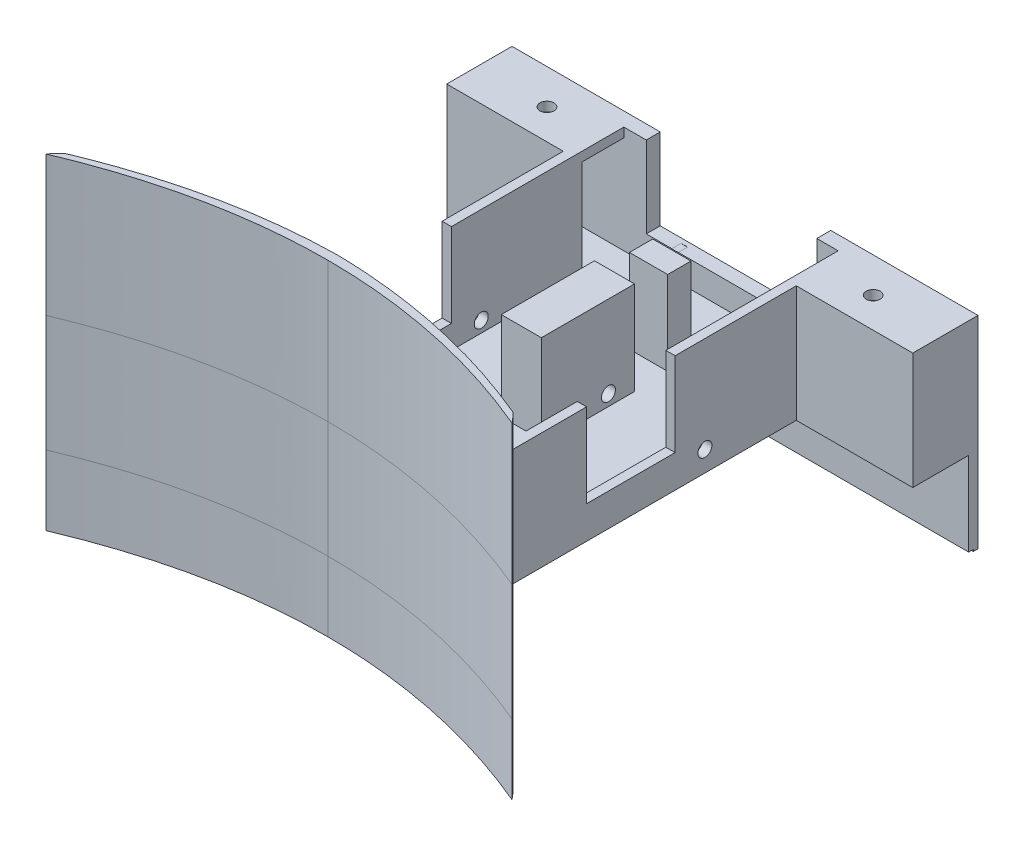
from build123d import *

# Parameters (mm, degrees)
SALIENTE_EXTRUIR1_DEPTH  = 25
VACIADO1_START           = 2
VACIADO1_DEPTH           = 23
CROQUIS3_W               = 10
CROQUIS3_H               = 18
CROQUIS3_W_2             = 5
CORTAR_EXTRUIR3_DEPTH    = 63
CROQUIS5_W               = 8.6
CROQUIS5_H               = 20
SALIENTE_EXTRUIR2_DEPTH  = 20
CROQUIS9_W               = 25
CROQUIS9_H               = 9
SALIENTE_EXTRUIR5_DEPTH  = 2
CORTAR_EXTRUIR4_DEPTH    = 13
SALIENTE_EXTRUIR8_DEPTH  = 30
SALIENTE_EXTRUIR9_DEPTH  = 15
SALIENTE_EXTRUIR11_REACH = 103.42
CROQUIS17_W              = 46
CROQUIS17_H              = 1
CORTAR_EXTRUIR5_REACH    = 83.24
CROQUIS18_W              = 26.5
CROQUIS18_H              = 17.5
CROQUIS19_R              = 1.5
CORTAR_EXTRUIR6_DEPTH    = 60
CORTAR_EXTRUIR7_REACH    = 83.24
CROQUIS20_R              = 1.5
CROQUIS21_W              = 4
CROQUIS21_H              = 18
CORTAR_EXTRUIR8_DEPTH    = 2
CROQUIS22_W              = 4
CROQUIS22_H              = 18
CORTAR_EXTRUIR9_DEPTH    = 2
CROQUIS23_W              = 36.597932746
CROQUIS23_H              = 17.450550814
CORTAR_EXTRUIR10_DEPTH   = 2
CROQUIS25_W              = 44.080721066
CROQUIS25_H              = 4.2
SALIENTE_EXTRUIR12_DEPTH = 18
CROQUIS29_W              = 3.5
CROQUIS29_H              = 4.2
CORTAR_EXTRUIR11_DEPTH   = 18
CROQUIS34_W              = 3.5
CROQUIS34_H              = 4.2
CORTAR_EXTRUIR12_DEPTH   = 18
CROQUIS35_W              = 8.2
CROQUIS35_H              = 5
SALIENTE_EXTRUIR13_DEPTH = 18
CROQUIS49_W              = 100
CROQUIS49_H              = 2
SALIENTE_EXTRUIR20_DEPTH = 14.5
CROQUIS50_W              = 100
CROQUIS50_H              = 1
SALIENTE_EXTRUIR21_DEPTH = 7.5
REDONDEO3_R              = 1
CROQUIS41_W              = 100
CROQUIS41_H              = 18.3920876
SALIENTE_EXTRUIR15_DEPTH = 1
CROQUIS46_W              = 100
CROQUIS46_H              = 18
SALIENTE_EXTRUIR17_DEPTH = 1
CROQUIS47_W              = 31.810608276
CROQUIS47_H              = 17.450550814
CROQUIS47_W_2            = 31.591458978
SALIENTE_EXTRUIR18_DEPTH = 1
CROQUIS48_W              = 100
CROQUIS48_H              = 7.549449186
SALIENTE_EXTRUIR19_DEPTH = 1


# Read off the part's stored shape, not the designer's step: Vaciado1, Saliente-Extruir8, Saliente-Extruir9
with BuildPart() as part:
    # Croquis1 → Saliente-Extruir1 (new body)
    with BuildSketch(Plane(origin=(0, 0, 0), x_dir=(1, 0, 0), z_dir=(0, 1, 0))):
        with BuildLine():
            Line((-50, 50), (50, 50))
            Line((50, 50), (50, 37))
            Line((50, 37), (25, 37))
            Line((25, 37), (25, -37))
            ThreePointArc((25, -37), (38.865424624, -40.155365367), (50, -49))
            add(Edge.make_bspline(
                [(50, -49), (25.069665495, -38.5), (0, -38.5)],
                knots=[0, 0, 0, 0.487509827, 0.487509827, 0.487509827], degree=2))
            add(Edge.make_bspline(
                [(-50, -49), (-25.069665495, -38.5), (0, -38.5)],
                knots=[0, 0, 0, 0.487509827, 0.487509827, 0.487509827], degree=2))
            ThreePointArc((-50, -49), (-38.865424624, -40.155365367), (-25, -37))
            Line((-25, -37), (-25, 37))
            Line((-25, 37), (-50, 37))
            Line((-50, 37), (-50, 50))
        make_face()
    extrude(amount=SALIENTE_EXTRUIR1_DEPTH)

    # Vaciado1 outline → Vaciado1 (cut)
    with BuildSketch(Plane(origin=(0, 0, 0), x_dir=(1, 0, 0), z_dir=(0, 1, 0)).offset(VACIADO1_START)):
        with BuildLine():
            ThreePointArc((40.360732069, -43.224043879), (32.7940153, -40.028651284), (24.64466366, -39.002101553))
            add(Edge.make_bspline(
                [(24.64466366, -39.002101553), (27.267975688, -39.535570601), (29.889798454, -40.137194866), (32.510049946, -40.806919812), (35.128659178, -41.544682347), (37.745568283, -42.350413884), (40.360732069, -43.224043879)],
                knots=[0.23606502, 0.23606502, 0.23606502, 0.23606502, 0.23606502, 0.23606502, 0.23606502, 0.387124221, 0.387124221, 0.387124221, 0.387124221, 0.387124221, 0.387124221, 0.387124221], degree=6))
        make_face()
        with BuildLine():
            ThreePointArc((-24.64466366, -39.002101553), (-32.7940153, -40.028651284), (-40.360732069, -43.224043879))
            add(Edge.make_bspline(
                [(-40.360732069, -43.224043879), (-37.745568283, -42.350413884), (-35.128659178, -41.544682347), (-32.510049946, -40.806919812), (-29.889798454, -40.137194866), (-27.267975688, -39.535570601), (-24.64466366, -39.002101553)],
                knots=[0.100385605, 0.100385605, 0.100385605, 0.100385605, 0.100385605, 0.100385605, 0.100385605, 0.251444807, 0.251444807, 0.251444807, 0.251444807, 0.251444807, 0.251444807, 0.251444807], degree=6))
        make_face()
        with BuildLine():
            Line((-23, 39), (-23.000000008, -38.678856831))
            add(Edge.make_bspline(
                [(-23.000000008, -38.678856831), (-19.173415883, -37.952848249), (-15.343739175, -37.371820066), (-11.511234649, -36.93593302), (-7.676214778, -36.645306639), (-3.839024177, -36.5), (3.839024177, -36.5), (7.676214778, -36.645306639), (11.511234649, -36.93593302), (15.343739175, -37.371820066), (19.173415883, -37.952848249), (23.000000008, -38.678856831)],
                knots=[0.267226703, 0.267226703, 0.267226703, 0.267226703, 0.267226703, 0.267226703, 0.267226703, 0.487509827, 0.487509827, 0.487509827, 0.487509827, 0.487509827, 0.70779295, 0.70779295, 0.70779295, 0.70779295, 0.70779295, 0.70779295, 0.70779295], degree=6))
            Line((23.000000008, -38.678856831), (23, 39))
            Line((23, 39), (48, 39))
            Line((48, 39), (48, 48))
            Line((48, 48), (-48, 48))
            Line((-48, 48), (-48, 39))
            Line((-48, 39), (-23, 39))
        make_face()
    extrude(amount=VACIADO1_DEPTH, mode=Mode.SUBTRACT)

    # Croquis3 → Cortar-Extruir3 (cut)
    with BuildSketch(Plane(origin=(25, 0, 0), x_dir=(0, 0, -1), z_dir=(1, 0, 0))):
        with Locations((-3, 16)):
            Rectangle(CROQUIS3_W, CROQUIS3_H)
        with Locations((8.5, 16)):
            Rectangle(CROQUIS3_W_2, CROQUIS3_H)
    extrude(amount=-CORTAR_EXTRUIR3_DEPTH, mode=Mode.SUBTRACT)

    # Croquis5 → Saliente-Extruir2 (add)
    with BuildSketch(Plane(origin=(0, 2, 0), x_dir=(1, 0, 0), z_dir=(0, 1, 0))):
        with Locations((0, 13)):
            Rectangle(CROQUIS5_W, CROQUIS5_H)
    extrude(amount=SALIENTE_EXTRUIR2_DEPTH)

    # Croquis9 → Saliente-Extruir5 (add)
    with BuildSketch(Plane(origin=(0, 25, 0), x_dir=(1, 0, 0), z_dir=(0, 1, 0))):
        with Locations((-35.5, 43.5)):
            Rectangle(CROQUIS9_W, CROQUIS9_H)
        with Locations((35.5, 43.5)):
            Rectangle(CROQUIS9_W, CROQUIS9_H)
    extrude(amount=-SALIENTE_EXTRUIR5_DEPTH)

    # Croquis2 → Cortar-Extruir4 (cut)
    with BuildSketch(Plane(origin=(0, 0, -50), x_dir=(-1, 0, 0), z_dir=(0, 0, -1))):
        with BuildLine():
            Line((17, 25), (7, 25))
            Line((7, 25), (7, 12.5))
            ThreePointArc((7, 12.5), (12, 7.5), (17, 12.5))
            Line((17, 12.5), (17, 25))
        make_face()
        with BuildLine():
            Line((-7, 12.5), (-7, 25))
            Line((-7, 25), (-17, 25))
            Line((-17, 25), (-17, 12.5))
            ThreePointArc((-17, 12.5), (-12, 7.5), (-7, 12.5))
        make_face()
    extrude(amount=-CORTAR_EXTRUIR4_DEPTH, mode=Mode.SUBTRACT)

    # Saliente-Extruir8 outline → Saliente-Extruir8 (add)
    with BuildSketch(Plane(origin=(0, 25, 0), x_dir=(1, 0, 0), z_dir=(0, 1, 0))):
        with BuildLine():
            ThreePointArc((-48.178880722, -46.919101462), (-49.111898963, -47.93989586), (-50, -49))
            add(Edge.make_bspline(
                [(-50, -49), (-25.069665493, -38.499999999), (4e-09, -38.5)],
                knots=[0.498431068, 0.498431068, 0.498431068, 0.500051325, 0.500051325, 0.500051325], degree=2))
            add(Edge.make_bspline(
                [(4e-09, -38.5), (25.069665495, -38.5), (50, -49)],
                knots=[0.499948675, 0.499948675, 0.499948675, 0.501568932, 0.501568932, 0.501568932], degree=2))
            ThreePointArc((50, -49), (49.111898963, -47.93989586), (48.178880723, -46.919101462))
            add(Edge.make_bspline(
                [(48.178880723, -46.919101462), (46.858484554, -46.365008442), (43.431854572, -44.984489744), (35.841757624, -42.260105988), (25.339635276, -39.32719595), (12.69476254, -37.138472388), (4.23860402, -36.564965521), (0, -36.5)],
                knots=[0.500023061, 0.500023061, 0.500023061, 0.500023061, 0.500151208, 0.50035374, 0.500758804, 0.501163868, 0.501568932, 0.501568932, 0.501568932, 0.501568932], degree=3))
            add(Edge.make_bspline(
                [(0, -36.5), (-4.23860402, -36.564965521), (-12.69476254, -37.138472388), (-25.339635276, -39.32719595), (-35.841757623, -42.260105987), (-43.431854572, -44.984489744), (-46.858484554, -46.365008441), (-48.178880722, -46.919101462)],
                knots=[0.498431068, 0.498431068, 0.498431068, 0.498431068, 0.498836132, 0.499241196, 0.49964626, 0.499848792, 0.499976939, 0.499976939, 0.499976939, 0.499976939], degree=3))
        make_face()
    extrude(amount=SALIENTE_EXTRUIR8_DEPTH)

    # Saliente-Extruir9 outline → Saliente-Extruir9 (add)
    with BuildSketch(Plane.XZ):
        with BuildLine():
            add(Edge.make_bspline(
                [(-48.178880722, 46.919101462), (-46.858484554, 46.365008441), (-43.431854571, 44.984489743), (-35.841757623, 42.260105987), (-25.339635276, 39.32719595), (-12.694762539, 37.138472388), (-4.23860402, 36.564965521), (0, 36.5)],
                knots=[0.498505454, 0.498505454, 0.498505454, 0.498505454, 0.4986336, 0.498836132, 0.499241196, 0.49964626, 0.500051325, 0.500051325, 0.500051325, 0.500051325], degree=3))
            add(Edge.make_bspline(
                [(0, 36.5), (4.23860402, 36.564965521), (12.69476254, 37.138472388), (25.339635276, 39.32719595), (35.841757624, 42.260105988), (43.431854572, 44.984489744), (46.858484554, 46.365008442), (48.178880723, 46.919101462)],
                knots=[0.499948675, 0.499948675, 0.499948675, 0.499948675, 0.50035374, 0.500758804, 0.501163868, 0.5013664, 0.501494546, 0.501494546, 0.501494546, 0.501494546], degree=3))
            ThreePointArc((48.178880723, 46.919101462), (49.111898963, 47.93989586), (50, 49))
            add(Edge.make_bspline(
                [(50, 49), (25.069665495, 38.5), (0, 38.5)],
                knots=[0.498431068, 0.498431068, 0.498431068, 0.500051325, 0.500051325, 0.500051325], degree=2))
            add(Edge.make_bspline(
                [(0, 38.5), (-25.069665486, 38.499999997), (-50, 49)],
                knots=[0.499948675, 0.499948675, 0.499948675, 0.501568932, 0.501568932, 0.501568932], degree=2))
            ThreePointArc((-50, 49), (-49.111898963, 47.93989586), (-48.178880722, 46.919101462))
        make_face()
    extrude(amount=SALIENTE_EXTRUIR9_DEPTH)

    # Croquis17 → Saliente-Extruir11 (add, up to next)
    with BuildSketch(Plane.XY.offset(19), mode=Mode.PRIVATE) as saliente_extruir11_sk1:
        with Locations((0, 24.5)):
            Rectangle(CROQUIS17_W, CROQUIS17_H)
    saliente_extruir11_tool1 = extrude(saliente_extruir11_sk1.sketch, amount=SALIENTE_EXTRUIR11_REACH, mode=Mode.PRIVATE) - part.part
    add(saliente_extruir11_tool1.solids().sort_by_distance((0, 24.5, 19))[0])

    # Croquis18 → Cortar-Extruir5 (cut, up to next)
    with BuildSketch(Plane(origin=(0, 25, 0), x_dir=(1, 0, 0), z_dir=(0, 1, 0)), mode=Mode.PRIVATE) as cortar_extruir5_sk1:
        with Locations((0, -27.75)):
            Rectangle(CROQUIS18_W, CROQUIS18_H)
    cortar_extruir5_tool1 = extrude(cortar_extruir5_sk1.sketch, amount=-CORTAR_EXTRUIR5_REACH, mode=Mode.PRIVATE) & part.part
    add(cortar_extruir5_tool1.solids().sort_by_distance((0, 25, 27.75))[0], mode=Mode.SUBTRACT)

    # Croquis19 → Cortar-Extruir6 (cut)
    with BuildSketch(Plane(origin=(25, 0, 0), x_dir=(0, 0, -1), z_dir=(1, 0, 0))):
        with Locations((17.4, 4.4)):
            Circle(CROQUIS19_R)
    extrude(amount=-CORTAR_EXTRUIR6_DEPTH, mode=Mode.SUBTRACT)

    # Croquis20 → Cortar-Extruir7 (cut, up to next)
    with BuildSketch(Plane(origin=(0, 25, 0), x_dir=(1, 0, 0), z_dir=(0, 1, 0)), mode=Mode.PRIVATE) as cortar_extruir7_sk1:
        with Locations(Location((17.25, -25, 0), (0, 0, 270))):
            Circle(CROQUIS20_R)
    cortar_extruir7_tool1 = extrude(cortar_extruir7_sk1.sketch, amount=-CORTAR_EXTRUIR7_REACH, mode=Mode.PRIVATE) & part.part
    # Croquis20 → Cortar-Extruir7 (cut, up to next)
    with BuildSketch(Plane(origin=(0, 25, 0), x_dir=(1, 0, 0), z_dir=(0, 1, 0)), mode=Mode.PRIVATE) as cortar_extruir7_sk2:
        with Locations(Location((-17.25, -25, 0), (0, 0, 270))):
            Circle(CROQUIS20_R)
    cortar_extruir7_tool2 = extrude(cortar_extruir7_sk2.sketch, amount=-CORTAR_EXTRUIR7_REACH, mode=Mode.PRIVATE) & part.part
    # Croquis20 → Cortar-Extruir7 (cut, up to next)
    with BuildSketch(Plane(origin=(0, 25, 0), x_dir=(1, 0, 0), z_dir=(0, 1, 0)), mode=Mode.PRIVATE) as cortar_extruir7_sk3:
        with Locations(Location((35, 43.5, 0), (0, 0, 270))):
            Circle(CROQUIS20_R)
    cortar_extruir7_tool3 = extrude(cortar_extruir7_sk3.sketch, amount=-CORTAR_EXTRUIR7_REACH, mode=Mode.PRIVATE) & part.part
    # Croquis20 → Cortar-Extruir7 (cut, up to next)
    with BuildSketch(Plane(origin=(0, 25, 0), x_dir=(1, 0, 0), z_dir=(0, 1, 0)), mode=Mode.PRIVATE) as cortar_extruir7_sk4:
        with Locations(Location((-35, 43.5, 0), (0, 0, 270))):
            Circle(CROQUIS20_R)
    cortar_extruir7_tool4 = extrude(cortar_extruir7_sk4.sketch, amount=-CORTAR_EXTRUIR7_REACH, mode=Mode.PRIVATE) & part.part
    add(cortar_extruir7_tool1.solids().sort_by_distance((17.25, 25, 25))[0], mode=Mode.SUBTRACT)
    add(cortar_extruir7_tool2.solids().sort_by_distance((-17.25, 25, 25))[0], mode=Mode.SUBTRACT)
    add(cortar_extruir7_tool3.solids().sort_by_distance((35, 25, -43.5))[0], mode=Mode.SUBTRACT)
    add(cortar_extruir7_tool4.solids().sort_by_distance((-35, 25, -43.5))[0], mode=Mode.SUBTRACT)

    # Croquis21 → Cortar-Extruir8 (cut)
    with BuildSketch(Plane(origin=(25, 0, 0), x_dir=(0, 0, -1), z_dir=(1, 0, 0))):
        with Locations((4, 16)):
            Rectangle(CROQUIS21_W, CROQUIS21_H)
    extrude(amount=-CORTAR_EXTRUIR8_DEPTH, mode=Mode.SUBTRACT)

    # Croquis22 → Cortar-Extruir9 (cut)
    with BuildSketch(Plane.ZY.offset(25)):
        with Locations((-4, 16)):
            Rectangle(CROQUIS22_W, CROQUIS22_H)
    extrude(amount=-CORTAR_EXTRUIR9_DEPTH, mode=Mode.SUBTRACT)

    # Croquis23 → Cortar-Extruir10 (cut)
    with BuildSketch(Plane(origin=(0, 0, -50), x_dir=(-1, 0, 0), z_dir=(0, 0, -1))):
        with Locations((-0.109574649, 16.274724593)):
            Rectangle(CROQUIS23_W, CROQUIS23_H)
    extrude(amount=-CORTAR_EXTRUIR10_DEPTH, mode=Mode.SUBTRACT)

    # Croquis25 → Saliente-Extruir12 (add)
    with BuildSketch(Plane(origin=(0, 2, 0), x_dir=(1, 0, 0), z_dir=(0, 1, 0))):
        with Locations((0.140384462, -16.141325676)):
            Rectangle(CROQUIS25_W, CROQUIS25_H)
    extrude(amount=SALIENTE_EXTRUIR12_DEPTH)

    # Croquis29 → Cortar-Extruir11 (cut)
    with BuildSketch(Plane(origin=(0, 20, 0), x_dir=(1, 0, 0), z_dir=(0, 1, 0))):
        with Locations((12.780744995, -16.141325676)):
            Rectangle(CROQUIS29_W, CROQUIS29_H)
    extrude(amount=-CORTAR_EXTRUIR11_DEPTH, mode=Mode.SUBTRACT)

    # Croquis34 → Cortar-Extruir12 (cut)
    with BuildSketch(Plane(origin=(0, 20, 0), x_dir=(1, 0, 0), z_dir=(0, 1, 0))):
        with Locations((-12.499976071, -16.141325676)):
            Rectangle(CROQUIS34_W, CROQUIS34_H)
    extrude(amount=-CORTAR_EXTRUIR12_DEPTH, mode=Mode.SUBTRACT)

    # Croquis35 → Saliente-Extruir13 (add)
    with BuildSketch(Plane(origin=(0, 2, 0), x_dir=(1, 0, 0), z_dir=(0, 1, 0))):
        with Locations((0, 32.8)):
            Rectangle(CROQUIS35_W, CROQUIS35_H)
    extrude(amount=SALIENTE_EXTRUIR13_DEPTH)

    # Croquis49 → Saliente-Extruir20 (add)
    with BuildSketch(Plane.XZ):
        with Locations((0, -50)):
            Rectangle(CROQUIS49_W, CROQUIS49_H)
    extrude(amount=SALIENTE_EXTRUIR20_DEPTH)

    # Croquis50 → Saliente-Extruir21 (add)
    with BuildSketch(Plane(origin=(0, 0, 0), x_dir=(1, 0, 0), z_dir=(0, 1, 0))):
        with Locations((0, 50.5)):
            Rectangle(CROQUIS50_W, CROQUIS50_H)
    extrude(amount=SALIENTE_EXTRUIR21_DEPTH)

    # Redondeo3
    redondeo3_edges = [part.edges().sort_by_distance(p)[0] for p in [
        (0, 7.5, -51),
    ]]
    fillet(redondeo3_edges, radius=REDONDEO3_R - 0.0001)  # a hair under: the kernel refuses the full size



with BuildPart() as body_2:
    # Croquis41 → Saliente-Extruir15 (new body)
    with BuildSketch(Plane(origin=(0, 0, -50), x_dir=(-1, 0, 0), z_dir=(0, 0, -1))):
        with Locations((0, -9.1960438)):
            Rectangle(CROQUIS41_W, CROQUIS41_H)
    extrude(amount=SALIENTE_EXTRUIR15_DEPTH)


with BuildPart() as part_1:
    add(part.part)

    add(body_2.part)  # Saliente-Extruir17 merges body 2
    # Croquis46 → Saliente-Extruir17 (add)
    with BuildSketch(Plane.XY.offset(-50)):
        with Locations((0, -9)):
            Rectangle(CROQUIS46_W, CROQUIS46_H)
    extrude(amount=SALIENTE_EXTRUIR17_DEPTH)

    # Croquis47 → Saliente-Extruir18 (add)
    with BuildSketch(Plane(origin=(0, 0, -50), x_dir=(-1, 0, 0), z_dir=(0, 0, -1))):
        with Locations((34.094695862, 16.274724593)):
            Rectangle(CROQUIS47_W, CROQUIS47_H)
        with Locations((-34.204270511, 16.274724593)):
            Rectangle(CROQUIS47_W_2, CROQUIS47_H)
    extrude(amount=SALIENTE_EXTRUIR18_DEPTH)

    # Croquis48 → Saliente-Extruir19 (add)
    with BuildSketch(Plane(origin=(0, 0, -50), x_dir=(-1, 0, 0), z_dir=(0, 0, -1))):
        with Locations((0, 3.774724593)):
            Rectangle(CROQUIS48_W, CROQUIS48_H)
    extrude(amount=SALIENTE_EXTRUIR19_DEPTH)


solid = part_1.part
